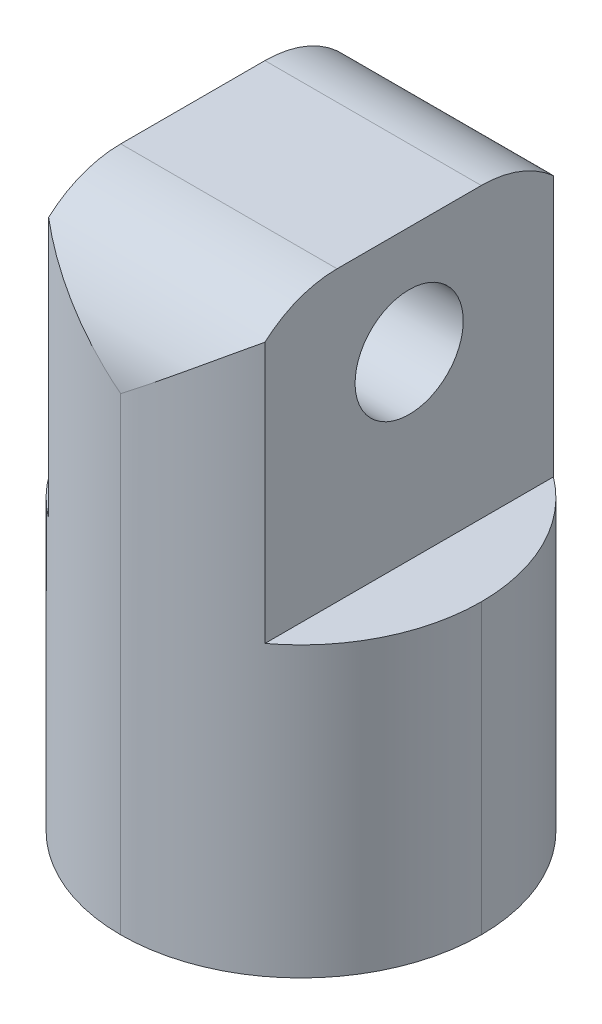
from build123d import *

# Parameters (mm, degrees)
SALIENTE_EXTRUIR1_DEPTH = 50
REDONDEO1_R             = 15
CROQUIS2_R              = 7.5
CORTAR_EXTRUIR1_DEPTH   = 30
REDONDEO3_R             = 25
CROQUIS3_R              = 7.5
CORTAR_EXTRUIR2_DEPTH   = 7.5


with BuildPart() as part:
    # Croquis1 → Saliente-Extruir1 (new body)
    with BuildSketch(Plane.XY):
        Polygon((0, 0), (30, 0), (30, -40), (40, -40), (40, -80), (-10, -80), (-10, -40), (0, -40), align=None)
    extrude(amount=SALIENTE_EXTRUIR1_DEPTH)

    # Redondeo1
    redondeo1_edges = [part.edges().sort_by_distance(p)[0] for p in [
        (15, 0, 0),
        (15, 0, 50),
    ]]
    fillet(redondeo1_edges, radius=REDONDEO1_R)

    # Croquis2 → Cortar-Extruir1 (cut)
    with BuildSketch(Plane(origin=(30, 0, 0), x_dir=(0, 0, -1), z_dir=(1, 0, 0))):
        with Locations(Location((-25, -15, 0), (0, 0, 90))):
            Circle(CROQUIS2_R)
    extrude(amount=-CORTAR_EXTRUIR1_DEPTH, mode=Mode.SUBTRACT)

    # Redondeo3
    # the kernel refuses this fillet: 25 mm, written as the material it takes off along each edge
    with BuildSketch(Plane(origin=(-10, -142.5, 50), x_dir=(1, 0, 0), z_dir=(0, 1, 0)), Plane(origin=(40, 22.5, 50), x_dir=(-1, 0, 0), z_dir=(0, -1, 0))) as redondeo3_piece_1:
        with BuildLine():
            CenterArc((REDONDEO3_R, REDONDEO3_R), REDONDEO3_R, 180, 90)
            Line((0, REDONDEO3_R), (0, 0))
            Line((0, 0), (REDONDEO3_R, 0))
        make_face()
    extrude(amount=165, mode=Mode.SUBTRACT)
    with BuildSketch(Plane(origin=(-10, -142.5, 0), x_dir=(1, 0, 0), z_dir=(0, 1, 0)), Plane(origin=(40, 22.5, 0), x_dir=(-1, 0, 0), z_dir=(0, -1, 0))) as redondeo3_piece_2:
        with BuildLine():
            CenterArc((REDONDEO3_R, -REDONDEO3_R), REDONDEO3_R, 90, 90)
            Line((0, -REDONDEO3_R), (0, 0))
            Line((0, 0), (REDONDEO3_R, 0))
        make_face()
    extrude(amount=165, mode=Mode.SUBTRACT)

    # Croquis3 → Cortar-Extruir2 (cut)
    with BuildSketch(Plane.XZ.offset(80)):
        with Locations(Location((15, 25, 0), (0, 0, 270))):
            Circle(CROQUIS3_R)
    extrude(amount=-CORTAR_EXTRUIR2_DEPTH, mode=Mode.SUBTRACT)


solid = part.part
